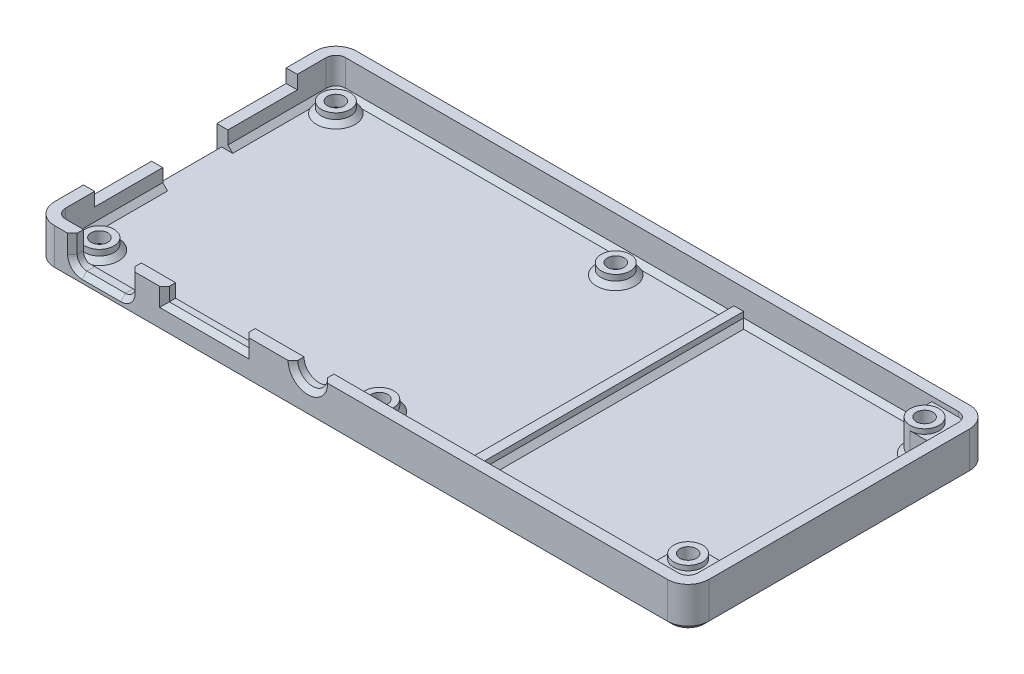
from build123d import *

# Parameters (mm, degrees)
SKETCH3_W                                         = 135.6
SKETCH3_H                                         = 62.6
SKETCH3_W_2                                       = 131
SKETCH3_H_2                                       = 58
BOSS_EXTRUDE1_DEPTH                               = 8.5
SKETCH5_W                                         = 131
SKETCH5_H                                         = 58
BOSS_EXTRUDE2_DEPTH                               = 2
SKETCH6_R                                         = 3
BOSS_EXTRUDE3_DEPTH                               = 2.2
SKETCH10_W                                        = 2
SKETCH10_H                                        = 58
BOSS_EXTRUDE4_DEPTH                               = 2.2
CUT_EXTRUDE1_REACH                                = 99.956
SKETCH11_R                                        = 3.1
SKETCH11_W                                        = 12
SKETCH11_H                                        = 5.8
SKETCH11_W_2                                      = 16.5
SKETCH11_H_2                                      = 2.8
CUT_EXTRUDE2_REACH                                = 142.155
SKETCH12_W                                        = 42
SKETCH12_H                                        = 2.8
SKETCH12_W_2                                      = 13.5
SKETCH12_H_2                                      = 3.7
FILLET6_R                                         = 2
FILLET8_R                                         = 2
CHAMFER1_SIZE                                     = 1
BOSS_EXTRUDE7_DEPTH                               = 6.5
FILLET20_R                                        = 4.3
CHAMFER5_SIZE                                     = 1
CSK_FOR_4_FLAT_HEAD_SOCKET_CAP_SCREW1_D           = 3.4544
CSK_FOR_4_FLAT_HEAD_SOCKET_CAP_SCREW1_DEPTH       = 14
CSK_FOR_4_FLAT_HEAD_SOCKET_CAP_SCREW1_CSINK_D     = 6.723761
CSK_FOR_4_FLAT_HEAD_SOCKET_CAP_SCREW1_CSINK_ANGLE = 82
CSK_FOR_4_FLAT_HEAD_SOCKET_CAP_SCREW1_TIP         = 1.037806461
CHAMFER7_SIZE                                     = 1
CHAMFER8_SIZE                                     = 1
CUT_EXTRUDE3_START                                = -1
CUT_EXTRUDE3_DEPTH                                = 1
FILLET21_R                                        = 2
CHAMFER9_SIZE                                     = 1


# Some blends are built 0.0001 mm under size
with BuildPart() as part:
    # Sketch3 → Boss-Extrude1 (new body)
    with BuildSketch(Plane(origin=(0, 0, 0), x_dir=(1, 0, 0), z_dir=(0, 1, 0))):
        with Locations((-7.061766162, 3.105993834)):
            Rectangle(SKETCH3_W, SKETCH3_H)
        with Locations((-7.061766162, 3.105993834)):
            Rectangle(SKETCH3_W_2, SKETCH3_H_2, mode=Mode.SUBTRACT)
    extrude(amount=BOSS_EXTRUDE1_DEPTH)

    # Sketch5 → Boss-Extrude2 (add)
    with BuildSketch(Plane(origin=(0, 0, 0), x_dir=(1, 0, 0), z_dir=(0, 1, 0))):
        with Locations((-7.061766162, 3.105993834)):
            Rectangle(SKETCH5_W, SKETCH5_H)
    extrude(amount=BOSS_EXTRUDE2_DEPTH)

    # Sketch6 → Boss-Extrude3 (add)
    with BuildSketch(Plane(origin=(0, 2, 0), x_dir=(1, 0, 0), z_dir=(0, 1, 0))):
        with Locations(Location((-68.061766162, 27.605993834, 0), (0, 0, 270))):
            Circle(SKETCH6_R)
        with Locations(Location((-68.061766162, -21.394006166, 0), (0, 0, 270))):
            Circle(SKETCH6_R)
        with Locations(Location((-10.061766162, -21.394006166, 0), (0, 0, 270))):
            Circle(SKETCH6_R)
        with Locations(Location((-10.061766162, 27.605993834, 0), (0, 0, 270))):
            Circle(SKETCH6_R)
    extrude(amount=BOSS_EXTRUDE3_DEPTH)

    # Sketch10 → Boss-Extrude4 (add)
    with BuildSketch(Plane(origin=(0, 2, 0), x_dir=(1, 0, 0), z_dir=(0, 1, 0))):
        with Locations((10.938233838, 3.105993834)):
            Rectangle(SKETCH10_W, SKETCH10_H)
    extrude(amount=BOSS_EXTRUDE4_DEPTH)

    # Sketch11 → Cut-Extrude1 (cut, up to next)
    with BuildSketch(Plane.XY.offset(28.194006166), mode=Mode.PRIVATE) as cut_extrude1_sk1:
        with Locations((-18.061766162, 8.5)):
            Circle(SKETCH11_R)
    cut_extrude1_tool1 = extrude(cut_extrude1_sk1.sketch, amount=-CUT_EXTRUDE1_REACH, mode=Mode.PRIVATE) & part.part
    # Sketch11 → Cut-Extrude1 (cut, up to next)
    with BuildSketch(Plane.XY.offset(28.194006166), mode=Mode.PRIVATE) as cut_extrude1_sk2:
        with Locations((-60.861766162, 5.6)):
            Rectangle(SKETCH11_W, SKETCH11_H)
    cut_extrude1_tool2 = extrude(cut_extrude1_sk2.sketch, amount=-CUT_EXTRUDE1_REACH, mode=Mode.PRIVATE) & part.part
    # Sketch11 → Cut-Extrude1 (cut, up to next)
    with BuildSketch(Plane.XY.offset(28.194006166), mode=Mode.PRIVATE) as cut_extrude1_sk3:
        with Locations((-39.527982648, 7.1)):
            Rectangle(SKETCH11_W_2, SKETCH11_H_2)
    cut_extrude1_tool3 = extrude(cut_extrude1_sk3.sketch, amount=-CUT_EXTRUDE1_REACH, mode=Mode.PRIVATE) & part.part
    add(cut_extrude1_tool1.solids().sort_by_distance((-18.061766, 8.5, 28.194006))[0], mode=Mode.SUBTRACT)
    add(cut_extrude1_tool2.solids().sort_by_distance((-60.861766, 5.6, 28.194006))[0], mode=Mode.SUBTRACT)
    add(cut_extrude1_tool3.solids().sort_by_distance((-39.527983, 7.1, 28.194006))[0], mode=Mode.SUBTRACT)

    # Sketch12 → Cut-Extrude2 (cut, up to next)
    with BuildSketch(Plane.ZY.offset(74.861766162), mode=Mode.PRIVATE) as cut_extrude2_sk1:
        with Locations((-3.105993834, 7.1)):
            Rectangle(SKETCH12_W, SKETCH12_H)
    cut_extrude2_tool1 = extrude(cut_extrude2_sk1.sketch, amount=-CUT_EXTRUDE2_REACH, mode=Mode.PRIVATE) & part.part
    # Sketch12 → Cut-Extrude2 (cut, up to next)
    with BuildSketch(Plane.ZY.offset(74.861766162), mode=Mode.PRIVATE) as cut_extrude2_sk2:
        with Locations((-2.982922372, 3.85)):
            Rectangle(SKETCH12_W_2, SKETCH12_H_2)
    cut_extrude2_tool2 = extrude(cut_extrude2_sk2.sketch, amount=-CUT_EXTRUDE2_REACH, mode=Mode.PRIVATE) & part.part
    add(cut_extrude2_tool1.solids().sort_by_distance((-74.861766, 7.1, -3.105994))[0], mode=Mode.SUBTRACT)
    add(cut_extrude2_tool2.solids().sort_by_distance((-74.861766, 3.85, -2.982922))[0], mode=Mode.SUBTRACT)

    # Fillet6
    fillet6_edges = [part.edges().sort_by_distance(p)[0] for p in [
        (58.438233838, 5.25, -32.105993834),
    ]]
    fillet(fillet6_edges, radius=FILLET6_R)

    # Fillet8
    fillet8_edges = [part.edges().sort_by_distance(p)[0] for p in [
        (-72.561766162, 5.25, -32.105993834),
        (-72.561766162, 5.25, 25.894006166),
    ]]
    fillet(fillet8_edges, radius=FILLET8_R)

    # Chamfer1
    chamfer1_edges = [part.edges().sort_by_distance(p)[0] for p in [
        (-68.061766162, 2, -30.605993834),
        (-68.061766162, 2, 18.394006166),
        (-10.061766162, 2, 18.394006166),
        (-10.061766162, 2, -30.605993834),
    ]]
    chamfer(chamfer1_edges, length=CHAMFER1_SIZE)

    # Sketch24 → Boss-Extrude7 (add)
    with BuildSketch(Plane(origin=(0, 2, 0), x_dir=(1, 0, 0), z_dir=(0, 1, 0))):
        with BuildLine():
            Line((53.938233838, -18.394006166), (58.438233838, -18.394006166))
            Line((58.438233838, -18.394006166), (58.438233838, -25.894006166))
            Line((58.438233838, -25.894006166), (50.938233838, -25.894006166))
            Line((50.938233838, -25.894006166), (50.938233838, -21.394006166))
            ThreePointArc((50.938233838, -21.394006166), (51.816913494, -19.272685822), (53.938233838, -18.394006166))
        make_face()
        with BuildLine():
            Line((50.938233838, 27.605993834), (50.938233838, 32.105993834))
            Line((50.938233838, 32.105993834), (58.438233838, 32.105993834))
            Line((58.438233838, 32.105993834), (58.438233838, 24.605993834))
            Line((58.438233838, 24.605993834), (53.938233838, 24.605993834))
            ThreePointArc((53.938233838, 24.605993834), (51.816913494, 25.484673491), (50.938233838, 27.605993834))
        make_face()
    extrude(amount=BOSS_EXTRUDE7_DEPTH)

    # Fillet20
    fillet20_edges = [part.edges().sort_by_distance(p)[0] for p in [
        (-74.861766162, 4.25, -34.405993834),
        (60.738233838, 4.25, -34.405993834),
        (60.738233838, 4.25, 28.194006166),
        (-74.861766162, 4.25, 28.194006166),
    ]]
    fillet(fillet20_edges, radius=FILLET20_R)

    # Chamfer5
    # the kernel refuses this chamfer: 1 mm, written as the material it adds along each edge
    with BuildSketch(Plane(origin=(-72.561766162, 2, 23.894006166), x_dir=(0.9996219169112968, -0.027495876610586605, 0), z_dir=(0, 0, -1))) as chamfer5_piece_1:
        Polygon((CHAMFER5_SIZE * 0.999621916911, -CHAMFER5_SIZE * 0.0274958766106), (-CHAMFER5_SIZE * 0.0274958766106, -CHAMFER5_SIZE * 0.999621916911), (0, 0), align=None)
    extrude(amount=20.126928538)
    with BuildSketch(Plane(origin=(-72.561766162, 2, -9.732922372), x_dir=(0.9996219169112968, -0.02749587661058639, 0), z_dir=(0, 0, -1))) as chamfer5_piece_2:
        Polygon((CHAMFER5_SIZE * 0.999621916911, -CHAMFER5_SIZE * 0.0274958766106), (-CHAMFER5_SIZE * 0.0274958766106, -CHAMFER5_SIZE * 0.999621916911), (0, 0), align=None)
    extrude(amount=20.373071462)
    with BuildSketch(Plane(origin=(-70.561766162, 2, 23.894006166), x_dir=(0, 0, 1), z_dir=(1, 0, 0))) as chamfer5_piece_3:
        Polygon((2 - CHAMFER5_SIZE, 0), (2, -CHAMFER5_SIZE), (2, 0), align=None)
    revolve(axis=Axis((-70.561766162, 2, 23.894006166), (0, -1, 0)), revolution_arc=90)
    with BuildSketch(Plane(origin=(-70.561766162, 2, -30.105993834), x_dir=(0, 0, -1), z_dir=(1, 0, 0))) as chamfer5_piece_4:
        Polygon((2 - CHAMFER5_SIZE, 0), (2, CHAMFER5_SIZE), (2, 0), align=None)
    revolve(axis=Axis((-70.561766162, 2, -30.105993834), (0, 1, 0)), revolution_arc=90)
    with BuildSketch(Plane(origin=(12.509916826, 2, 25.894006166), x_dir=(0, -0.027495876610586296, -0.9996219169112968), z_dir=(-1, 0, 0))) as chamfer5_piece_5_section:
        Polygon((CHAMFER5_SIZE * 0.999621916911, -CHAMFER5_SIZE * 0.0274958766106), (-CHAMFER5_SIZE * 0.0274958766106, -CHAMFER5_SIZE * 0.999621916911), (0, 0), align=None)
    chamfer5_piece_5 = extrude(amount=83.071682988, mode=Mode.PRIVATE)
    chamfer5_piece_5 = split(chamfer5_piece_5, bisect_by=Plane(origin=(12.224075332, 2.7, 25.537595909), z_dir=(0, -1, 0)), keep=Keep.TOP, mode=Mode.PRIVATE)
    add(chamfer5_piece_5)
    with BuildSketch(Plane(origin=(12.509916826, 2, 25.894006166), x_dir=(0, -0.027495876610586296, -0.9996219169112968), z_dir=(-1, 0, 0))) as chamfer5_piece_6_section:
        Polygon((CHAMFER5_SIZE * 0.999621916911, -CHAMFER5_SIZE * 0.0274958766106), (-CHAMFER5_SIZE * 0.0274958766106, -CHAMFER5_SIZE * 0.999621916911), (0, 0), align=None)
    chamfer5_piece_6 = extrude(amount=83.071682988, mode=Mode.PRIVATE)
    chamfer5_piece_6 = split(chamfer5_piece_6, bisect_by=Plane(origin=(-54.861766162, 2.8, 25.794006166), z_dir=(1, 0, 0)), keep=Keep.TOP, mode=Mode.PRIVATE)
    add(chamfer5_piece_6)
    with BuildSketch(Plane(origin=(12.509916826, 2, 25.894006166), x_dir=(0, -0.027495876610586296, -0.9996219169112968), z_dir=(-1, 0, 0))) as chamfer5_piece_7_section:
        Polygon((CHAMFER5_SIZE * 0.999621916911, -CHAMFER5_SIZE * 0.0274958766106), (-CHAMFER5_SIZE * 0.0274958766106, -CHAMFER5_SIZE * 0.999621916911), (0, 0), align=None)
    chamfer5_piece_7 = extrude(amount=83.071682988, mode=Mode.PRIVATE)
    chamfer5_piece_7 = split(chamfer5_piece_7, bisect_by=Plane(origin=(-66.861766162, 2.802568974, 25.79914411), z_dir=(-1, 0, 0)), keep=Keep.TOP, mode=Mode.PRIVATE)
    add(chamfer5_piece_7)
    with BuildSketch(Plane(origin=(-70.561766162, 2, -32.105993834), x_dir=(0, -0.027495876610586605, 0.9996219169112968), z_dir=(1, 0, 0))) as chamfer5_piece_8:
        Polygon((CHAMFER5_SIZE * 0.999621916911, -CHAMFER5_SIZE * 0.0274958766106), (-CHAMFER5_SIZE * 0.0274958766106, -CHAMFER5_SIZE * 0.999621916911), (0, 0), align=None)
    extrude(amount=83.071682988)
    with BuildSketch(Plane(origin=(9.938233838, 2, 25.894006166), x_dir=(-0.9996219169112968, -0.027495876610586556, 0), z_dir=(0, 0, -1))) as chamfer5_piece_9:
        Polygon((CHAMFER5_SIZE * 0.999621916911, CHAMFER5_SIZE * 0.0274958766106), (-CHAMFER5_SIZE * 0.0274958766106, CHAMFER5_SIZE * 0.999621916911), (0, 0), align=None)
    extrude(amount=58)
    with BuildSketch(Plane(origin=(11.938233838, 2, -32.105993834), x_dir=(-0.027495876610585623, 0.9996219169112968, 0), z_dir=(0, 0, 1))) as chamfer5_piece_10:
        Polygon((CHAMFER5_SIZE * 0.999621916911, -CHAMFER5_SIZE * 0.0274958766106), (-CHAMFER5_SIZE * 0.0274958766106, -CHAMFER5_SIZE * 0.999621916911), (0, 0), align=None)
    extrude(amount=58)
    with BuildSketch(Plane(origin=(9.36655085, 2, -32.105993834), x_dir=(0, 0.9996219169112968, -0.027495876610589075), z_dir=(1, 0, 0)), Plane(origin=(53.509916826, 2, 25.894006166), x_dir=(0, 0.9996219169112968, 0.027495876610585623), z_dir=(-1, 0, 0))) as chamfer5_piece_11:
        Polygon((CHAMFER5_SIZE * 0.999621916911, CHAMFER5_SIZE * 0.0274958766106), (-CHAMFER5_SIZE * 0.0274958766106, CHAMFER5_SIZE * 0.999621916911), (0, 0), align=None)
    extrude(amount=44.143365976)
    with BuildSketch(Plane(origin=(53.938233838, 2, 21.394006166), x_dir=(-1, 0, 0), z_dir=(0, 0, 1))) as chamfer5_piece_12:
        Polygon((3, -CHAMFER5_SIZE), (3 + CHAMFER5_SIZE, 0), (3, 0), align=None)
    revolve(axis=Axis((53.938233838, 2, 21.394006166), (0, -1, 0)), revolution_arc=90)
    with BuildSketch(Plane(origin=(58.438233838, 2, -27.177676822), x_dir=(0.02749587661058907, 0.9996219169112965, 0), z_dir=(0, 0, 1))) as chamfer5_piece_13:
        Polygon((CHAMFER5_SIZE * 0.999621916911, CHAMFER5_SIZE * 0.0274958766106), (-CHAMFER5_SIZE * 0.0274958766106, CHAMFER5_SIZE * 0.999621916911), (0, 0), align=None)
    extrude(amount=48.143365976)
    with BuildSketch(Plane(origin=(53.938233838, 2, -27.605993834), x_dir=(0, 0, 1), z_dir=(1, 0, 0))) as chamfer5_piece_14:
        Polygon((3, -CHAMFER5_SIZE), (3 + CHAMFER5_SIZE, 0), (3, 0), align=None)
    revolve(axis=Axis((53.938233838, 2, -27.605993834), (0, -1, 0)), revolution_arc=90)
    with BuildSketch(Plane(origin=(50.938233838, 2, 25.894006166), x_dir=(0.02749587661058907, 0.9996219169112965, 0), z_dir=(0, 0, -1)), Plane(origin=(53.938233838, 2, 18.394006166), x_dir=(0, 0.9996219169112968, 0.027495876610585623), z_dir=(1, 0, 0)), Plane(origin=(58.438233838, 2, -24.605993834), x_dir=(0, 0.9996219169112968, -0.027495876610585623), z_dir=(-1, 0, 0)), Plane(origin=(50.938233838, 2, -27.605993834), x_dir=(0.02749587661058907, 0.9996219169112965, 0), z_dir=(0, 0, -1))) as chamfer5_piece_15:
        Polygon((CHAMFER5_SIZE * 0.999621916911, -CHAMFER5_SIZE * 0.0274958766106), (-CHAMFER5_SIZE * 0.0274958766106, -CHAMFER5_SIZE * 0.999621916911), (0, 0), align=None)
    extrude(amount=4.5)

    # CSK for #4 Flat Head Socket Cap Screw1
    with Locations(Plane(origin=(0, 0, 0), x_dir=(-1, 0, 0), z_dir=(0, -1, 0))):
        with Locations((68.061766162, 27.605993834), (68.061766162, -21.394006166), (-53.938233838, 27.605993834), (-53.938233838, -21.394006166), (10.061766162, -21.394006166), (10.061766162, 27.605993834)):
            CounterSinkHole(CSK_FOR_4_FLAT_HEAD_SOCKET_CAP_SCREW1_D / 2, CSK_FOR_4_FLAT_HEAD_SOCKET_CAP_SCREW1_CSINK_D / 2, depth=CSK_FOR_4_FLAT_HEAD_SOCKET_CAP_SCREW1_DEPTH, counter_sink_angle=CSK_FOR_4_FLAT_HEAD_SOCKET_CAP_SCREW1_CSINK_ANGLE)
            with Locations((0, 0, -(CSK_FOR_4_FLAT_HEAD_SOCKET_CAP_SCREW1_DEPTH + CSK_FOR_4_FLAT_HEAD_SOCKET_CAP_SCREW1_TIP / 2))):  # 118° drill point
                Cone(0, CSK_FOR_4_FLAT_HEAD_SOCKET_CAP_SCREW1_D / 2, CSK_FOR_4_FLAT_HEAD_SOCKET_CAP_SCREW1_TIP, mode=Mode.SUBTRACT)

    # Chamfer7
    chamfer7_edges = [part.edges().sort_by_distance(p)[0] for p in [
        (-7.061766162, 0, -34.405993834),
        (-74.861766162, 0, -3.105993834),
        (60.738233838, 0, -3.105993834),
        (-7.061766162, 0, 28.194006166),
        (59.478792997, 0, 26.934565325),
        (-73.602325321, 0, 26.934565325),
        (-73.602325321, 0, -33.146552993),
        (59.478792997, 0, -33.146552993),
    ]]
    chamfer(chamfer7_edges, length=CHAMFER7_SIZE)

    # Chamfer8
    chamfer8_edges = [part.edges().sort_by_distance(p)[0] for p in [
        (-74.861766162, 2, -2.982922372),
    ]]
    chamfer(chamfer8_edges, length=CHAMFER8_SIZE - 0.0001)  # a hair under: the kernel refuses the full size

    # Sketch29 → Cut-Extrude3 (cut)
    with BuildSketch(Plane(origin=(0, 8.5, 0), x_dir=(1, 0, 0), z_dir=(0, 1, 0)).offset(CUT_EXTRUDE3_START)):
        with BuildLine():
            Line((53.938233838, 24.605993834), (58.438233838, 24.605993834))
            Line((58.438233838, 24.605993834), (58.438233838, 30.105993834))
            ThreePointArc((58.438233838, 30.105993834), (57.8524474, 31.520207397), (56.438233838, 32.105993834))
            Line((56.438233838, 32.105993834), (50.938233838, 32.105993834))
            Line((50.938233838, 32.105993834), (50.938233838, 27.605993834))
            ThreePointArc((50.938233838, 27.605993834), (56.059554181, 29.727314178), (53.938233838, 24.605993834))
        make_face()
        with BuildLine():
            Line((53.938233838, -18.394006166), (58.438233838, -18.394006166))
            Line((58.438233838, -18.394006166), (58.438233838, -23.894006166))
            ThreePointArc((58.438233838, -23.894006166), (57.8524474, -25.308219728), (56.438233838, -25.894006166))
            Line((56.438233838, -25.894006166), (50.938233838, -25.894006166))
            Line((50.938233838, -25.894006166), (50.938233838, -21.394006166))
            ThreePointArc((50.938233838, -21.394006166), (56.059554181, -23.515326509), (53.938233838, -18.394006166))
        make_face()
    extrude(amount=CUT_EXTRUDE3_DEPTH, mode=Mode.SUBTRACT)

    # Fillet21
    fillet21_edges = [part.edges().sort_by_distance(p)[0] for p in [
        (-54.861766162, 2.7, 26.894006166),
        (-66.861766162, 2.7, 26.894006166),
    ]]
    fillet(fillet21_edges, radius=FILLET21_R)

    # Chamfer9
    chamfer9_edges = [part.edges().sort_by_distance(p)[0] for p in [
        (-18.061766162, 5.4, 28.194006166),
        (-54.861766162, 6.6, 28.194006166),
        (-60.861766162, 2.7, 28.194006166),
        (-55.4475526, 3.285786438, 28.194006166),
        (-66.275979725, 3.285786438, 28.194006166),
        (-66.861766162, 6.6, 28.194006166),
        (-47.777982648, 7.1, 28.194006166),
        (-39.527982648, 5.7, 28.194006166),
        (-31.277982648, 7.1, 28.194006166),
    ]]
    chamfer(chamfer9_edges, length=CHAMFER9_SIZE)


solid = part.part
